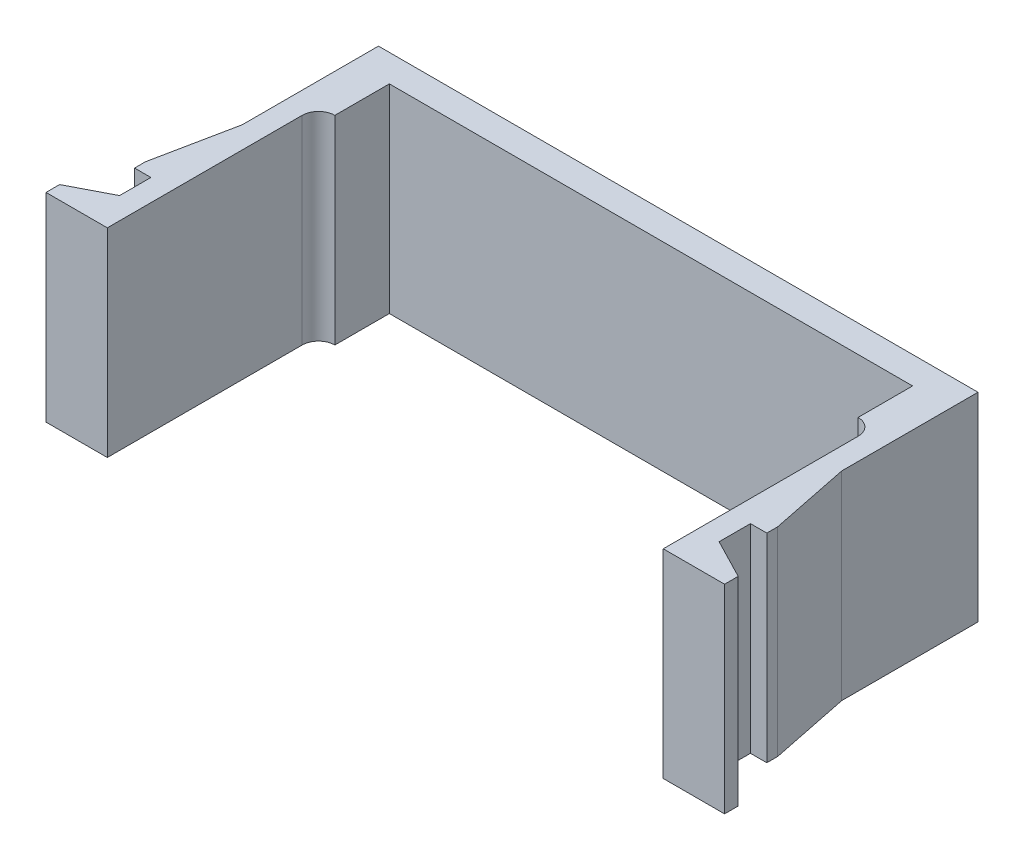
from build123d import *

# Parameters (mm, degrees)
SKETCH_1_W             = 44
SKETCH_1_H             = 14.6
EXTRUDE_1_DEPTH        = 2
SKETCH_2_W             = 2.8
SKETCH_2_H             = 14.6
EXTRUDE_2_DEPTH        = 4
EXTRUDE_3_DEPTH        = 14.6
FILLET_1_R             = 1.2
FILLET_1_OF_MIRROR_1_R = 1.2


with BuildPart() as part:
    # 草图1 → 凸台-拉伸1 (new body)
    with BuildSketch(Plane.XY):
        Rectangle(SKETCH_1_W, SKETCH_1_H)
    extrude(amount=EXTRUDE_1_DEPTH)

    # 草图2 → 凸台-拉伸2 (add)
    with BuildSketch(Plane.XY.offset(2)):
        with Locations((20.6, 0)):
            Rectangle(SKETCH_2_W, SKETCH_2_H)
    extrude_2 = extrude(amount=EXTRUDE_2_DEPTH)

    # 草图3 → 凸台-拉伸3 (add)
    with BuildSketch(Plane.XZ.offset(7.3)):
        Polygon((22, 6), (20.4, 6), (20.4, 21.5), (24.9, 21.5), (24.9, 20.5), (22, 19), (22, 16.7), (23.2, 16.7), (23.2, 15.9), (22, 10), align=None)
    extrude_3 = extrude(amount=-EXTRUDE_3_DEPTH)

    # 圆角1
    fillet_1_edges = [part.edges().sort_by_distance(p)[0] for p in [
        (20.4, 0, 6),
    ]]
    fillet(fillet_1_edges, radius=FILLET_1_R - 0.0001)  # a hair under: the kernel refuses the full size

    # 镜向1: 凸台-拉伸2, 凸台-拉伸3 across plane
    add(extrude_2.mirror(Plane(origin=(0, 0, 0), x_dir=(0, 0, 1), z_dir=(1, 0, 0))))
    add(extrude_3.mirror(Plane(origin=(0, 0, 0), x_dir=(0, 0, 1), z_dir=(1, 0, 0))))

    # 圆角1 of 镜向1
    fillet_1_of_mirror_1_edges = [part.edges().sort_by_distance(p)[0] for p in [
        (-20.4, 0, 6),
    ]]
    fillet(fillet_1_of_mirror_1_edges, radius=FILLET_1_OF_MIRROR_1_R - 0.0001)  # a hair under: the kernel refuses the full size


solid = part.part
